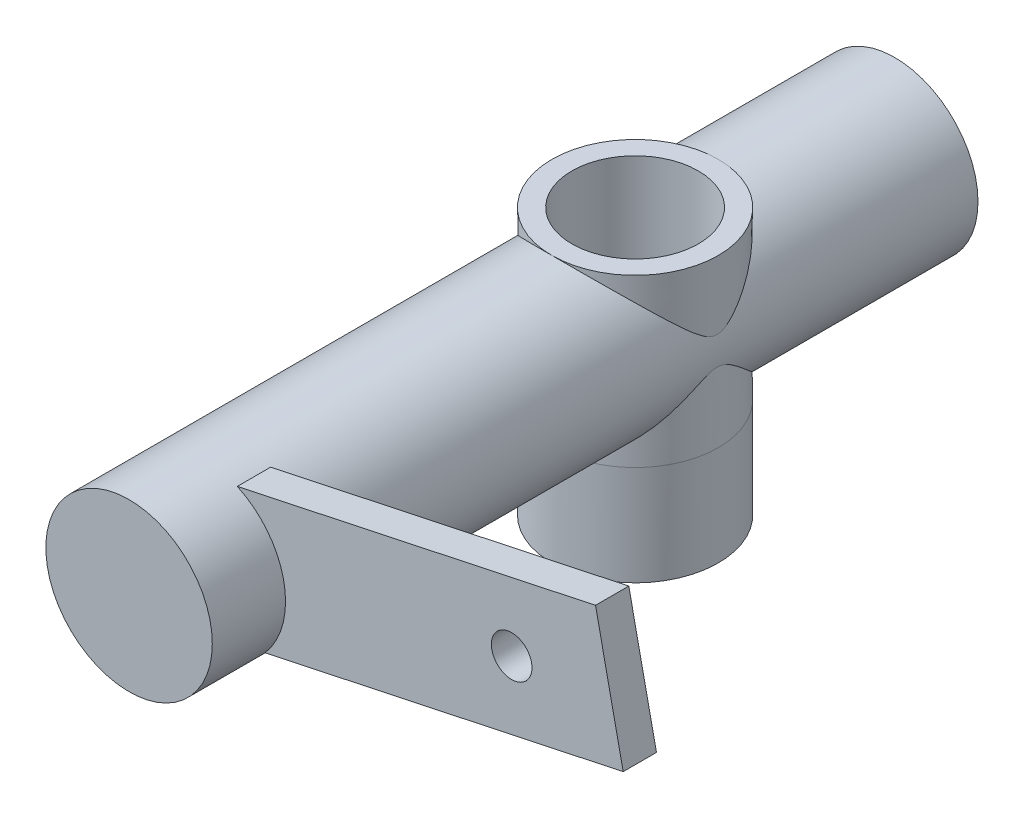
from build123d import *

# Parameters (mm, degrees)
SKETCH1_R           = 6.35
BOSS_EXTRUDE1_DEPTH = 58.42
BOSS_EXTRUDE3_START = -2.54
SKETCH7_W           = 10.16
SKETCH7_H           = 2.54
BOSS_EXTRUDE3_DEPTH = 27.94
SKETCH10_R          = 1.55
CUT_EXTRUDE2_DEPTH  = 64.384429767
SKETCH13_R          = 4.826
CUT_EXTRUDE3_DEPTH  = 72.389091006


# Read off the part's stored shape, not the designer's step: Boss-Extrude2, Boss-Extrude4
with BuildPart() as part:
    # Sketch1 → Boss-Extrude1 (new body)
    with BuildSketch(Plane.XY):
        with Locations(Location((0, 0, 0), (0, 0, 180))):
            Circle(SKETCH1_R)
    extrude(amount=BOSS_EXTRUDE1_DEPTH)

    # Boss-Extrude2 outline → Boss-Extrude2 (revolve)
    with BuildSketch(Plane.XY.offset(19.812)):
        Polygon((6.35, -13.97), (6.35, -6.35), (6.257921095, -1.074803042), (0, -1.074803042), (0, -13.97), align=None)
    revolve(axis=Axis((0, 0, 19.812), (0, 1, 0)))

    # Sketch7 → Boss-Extrude3 (add)
    with BuildSketch(Plane(origin=(6.211237265, 1.320239237, 0), x_dir=(0.20791169081776328, -0.9781476007338049, 0), z_dir=(0.9781476007338049, 0.20791169081776328, 0)).offset(BOSS_EXTRUDE3_START)):
        with Locations((0, -51.562)):
            Rectangle(SKETCH7_W, SKETCH7_H)
    extrude(amount=BOSS_EXTRUDE3_DEPTH)

    # Sketch10 → Cut-Extrude2 (cut, through all)
    with BuildSketch(Plane.XY.offset(52.832)):
        with Locations((23.602701606, 5.016909099)):
            Circle(SKETCH10_R)
    extrude(amount=-CUT_EXTRUDE2_DEPTH, mode=Mode.SUBTRACT)

    # Boss-Extrude4 outline → Boss-Extrude4 (revolve)
    with BuildSketch(Plane.XY.offset(19.812)):
        Polygon((0, 6.350021501), (0, 1.075341111), (6.257930487, 1.075341111), (6.350000375, 6.350021501), align=None)
    revolve(axis=Axis((0, 0, 19.812), (0, 1, 0)))

    # Sketch13 → Cut-Extrude3 (cut, through all)
    with BuildSketch(Plane.XZ.offset(13.97)):
        with Locations(Location((0, 19.812, 0), (0, 0, 270))):
            Circle(SKETCH13_R)
    extrude(amount=-CUT_EXTRUDE3_DEPTH, mode=Mode.SUBTRACT)


solid = part.part
